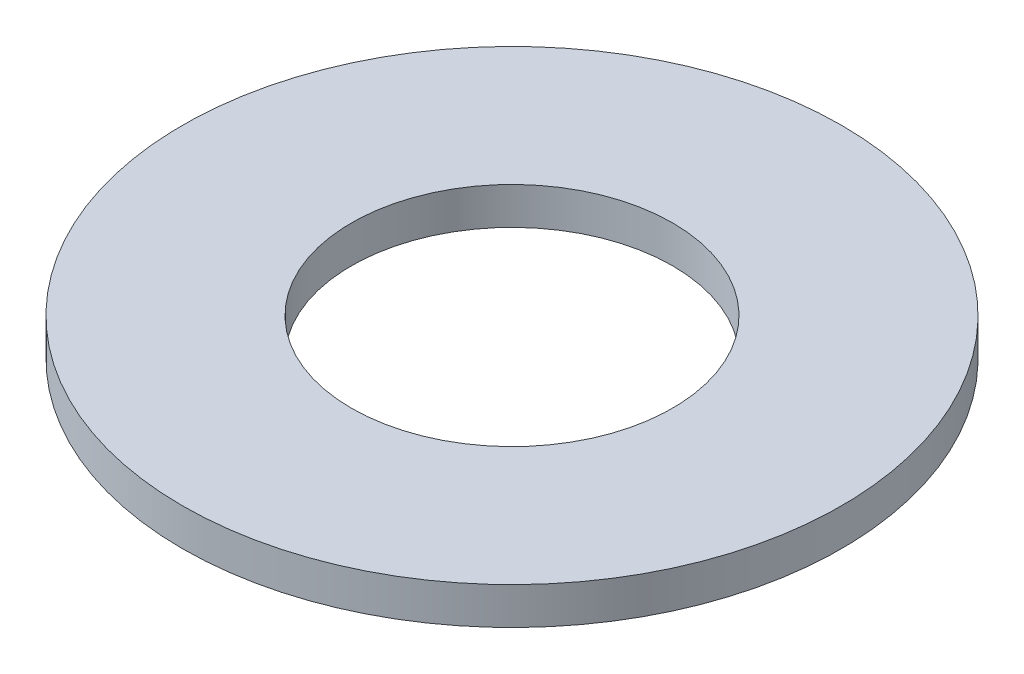
from build123d import *

# Parameters (mm, degrees)
SKETCH1_R           = 97.5
BOSS_EXTRUDE1_DEPTH = 11
SKETCH2_R           = 47.5
CUT_EXTRUDE1_DEPTH  = 139.32389526


with BuildPart() as part:
    # Sketch1 → Boss-Extrude1 (new body)
    with BuildSketch(Plane(origin=(0, 0, 0), x_dir=(1, 0, 0), z_dir=(0, 1, 0))):
        Circle(SKETCH1_R)
    extrude(amount=BOSS_EXTRUDE1_DEPTH)

    # Sketch2 → Cut-Extrude1 (cut, through all)
    with BuildSketch(Plane(origin=(0, 0, 0), x_dir=(1, 0, 0), z_dir=(0, 1, 0))):
        Circle(SKETCH2_R)
    extrude(amount=CUT_EXTRUDE1_DEPTH, mode=Mode.SUBTRACT)


solid = part.part
